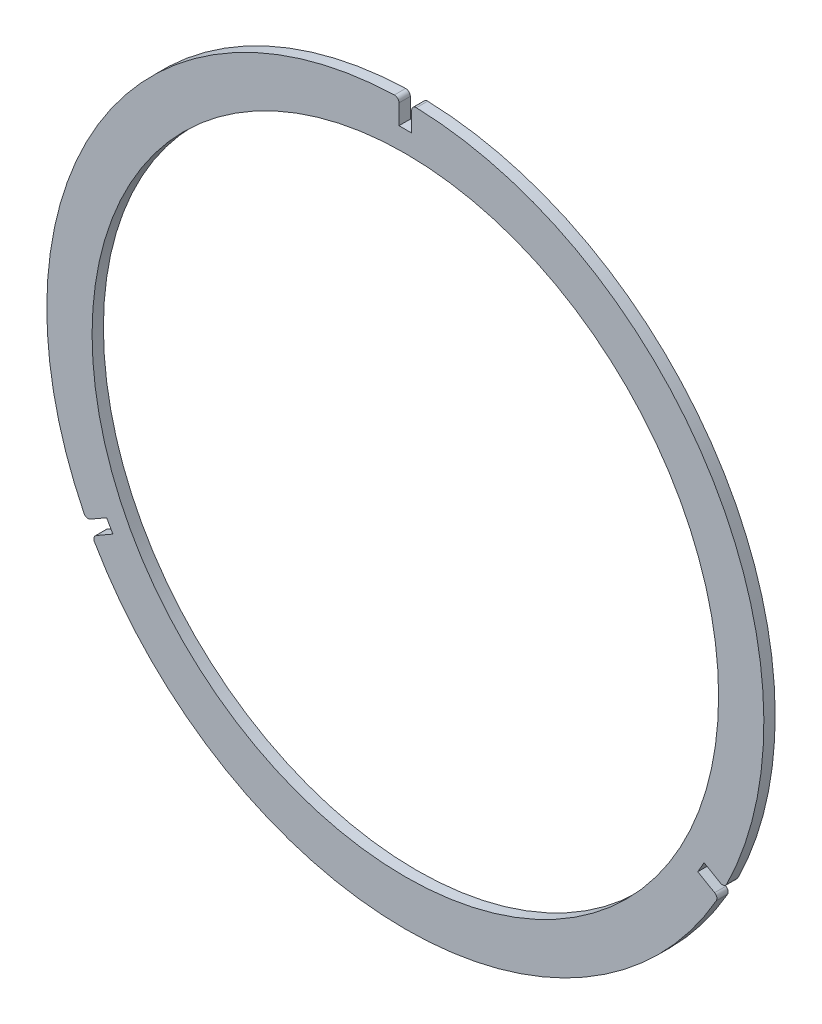
from build123d import *

# Parameters (mm, degrees)
BOSS_EXTRUDE1_DEPTH = 3.175
FILLET2_R           = 1.27


with BuildPart() as part:
    # Sketch2 → Boss-Extrude1 (new body)
    with BuildSketch(Plane.XY):
        with BuildLine():
            Line((-1.783927604, 106.664181958), (-1.783927604, 99.822))
            Line((-1.783927604, 99.822), (1.783927604, 99.822))
            Line((1.783927604, 99.822), (1.783927604, 106.664181958))
            ThreePointArc((1.783927604, 106.664181958), (86.289926541, 57.796410124), (89.548347912, -39.767444199))
            Line((89.548347912, -39.767444199), (83.828949259, -36.465733272))
            Line((83.828949259, -36.465733272), (82.051104913, -39.54540947))
            Line((82.051104913, -39.54540947), (87.770503566, -42.847120397))
            Line((87.770503566, -42.847120397), (87.87121564, -42.905259753))
            ThreePointArc((87.87121564, -42.905259753), (0, -94.523651503), (-87.87121564, -42.905259753))
            Line((-87.87121564, -42.905259753), (-87.770503566, -42.847120397))
            Line((-87.770503566, -42.847120397), (-82.051104913, -39.54540947))
            Line((-82.051104913, -39.54540947), (-83.828949259, -36.465733272))
            Line((-83.828949259, -36.465733272), (-89.548347912, -39.767444199))
            ThreePointArc((-89.548347912, -39.767444199), (-86.289926541, 57.796410124), (-1.783927604, 106.664181958))
        make_face()
        with BuildLine():
            ThreePointArc((-7.652045127, 93.646303016), (0, -81.823651503), (7.652045127, 93.646303016))
            ThreePointArc((7.652045127, 93.646303016), (4.717664566, 93.853310885), (1.778000524, 93.962016248))
            ThreePointArc((1.778000524, 93.962016248), (0.889045735, 93.975503947), (0, 93.98))
            ThreePointArc((0, 93.98), (-0.889045735, 93.975503947), (-1.778000524, 93.962016248))
            ThreePointArc((-1.778000524, 93.962016248), (-4.717664566, 93.853310885), (-7.652045127, 93.646303016))
        make_face(mode=Mode.SUBTRACT)
    extrude(amount=-BOSS_EXTRUDE1_DEPTH)

    # Fillet2
    fillet2_edges = [part.edges().sort_by_distance(p)[0] for p in [
        (-1.783927604, 106.664181958, -1.5875),
        (-87.87121564, -42.905259753, -1.5875),
        (-89.548347912, -39.767444199, -1.5875),
        (89.548347912, -39.767444199, -1.5875),
        (87.87121564, -42.905259753, -1.5875),
        (1.783927604, 106.664181958, -1.5875),
    ]]
    fillet(fillet2_edges, radius=FILLET2_R)


solid = part.part
